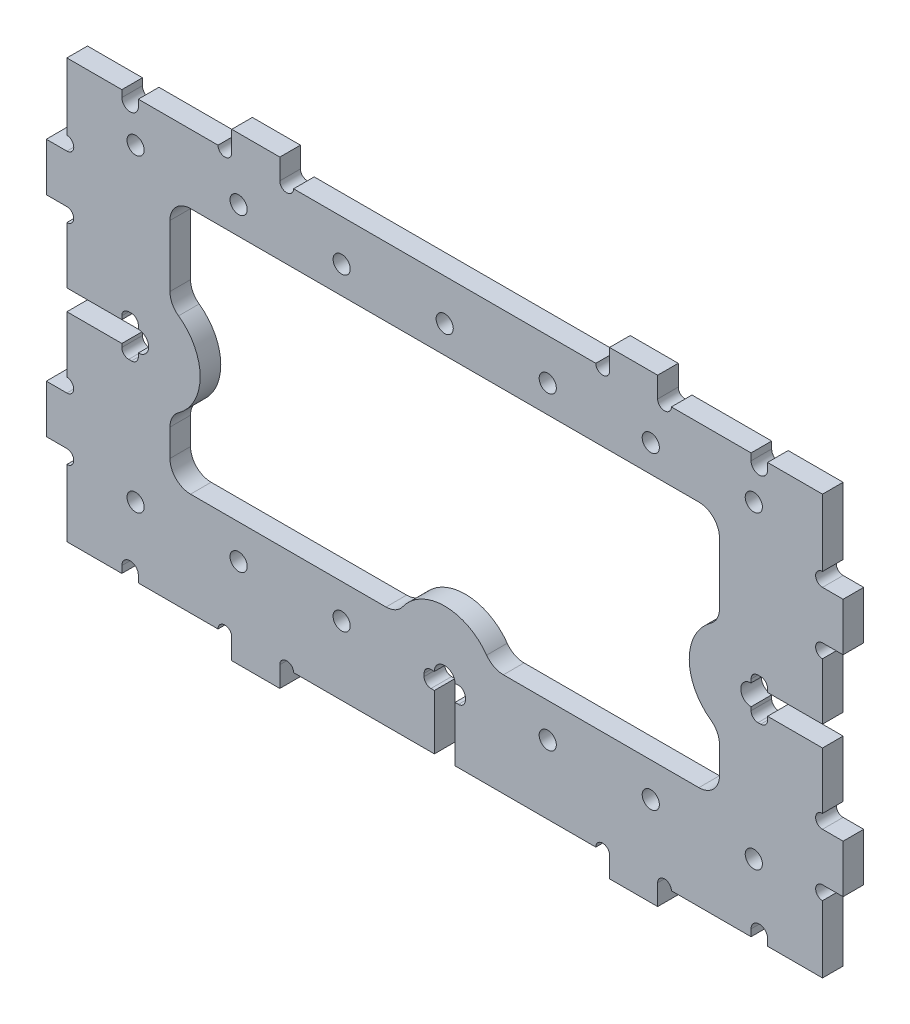
from build123d import *

# Parameters (mm, degrees)
BOSS_EXTRUDE1_DEPTH          = 3
CUT_EXTRUDE1_DEPTH           = 3
CUT_EXTRUDE3_DEPTH           = 3
FILLET2_R                    = 1
CUT_EXTRUDE4_DEPTH           = 10
FILLET3_R                    = 3
SKETCH5_W                    = 3
SKETCH5_H                    = 7
SKETCH5_W_2                  = 7
SKETCH5_H_2                  = 3
BOSS_EXTRUDE2_DEPTH          = 3
F_2_0_2_DIAMETER_HOLE1_D     = 2
F_2_0_2_DIAMETER_HOLE1_DEPTH = 6
F_2_0_2_DIAMETER_HOLE1_TIP   = 0.600860619
SKETCH9_R                    = 1.25
CUT_EXTRUDE5_DEPTH           = 10


with BuildPart() as part:
    # Sketch1 → Boss-Extrude1 (new body)
    with BuildSketch(Plane.XY):
        with BuildLine():
            Line((55, 30.5), (-55, 30.5))
            Line((-55, 30.5), (-55, 1.5))
            Line((-55, 1.5), (-47, 1.5))
            Line((-47, 1.5), (-47, 2))
            ThreePointArc((-47, 2), (-46.707106781, 2.707106781), (-46, 3))
            Line((-46, 3), (-45.6, 3))
            ThreePointArc((-45.6, 3), (-44.892893219, 2.707106781), (-44.6, 2))
            Line((-44.6, 2), (-44.6, 1.5))
            ThreePointArc((-44.6, 1.5), (-43.1, 0), (-44.6, -1.5))
            Line((-44.6, -1.5), (-44.6, -2))
            ThreePointArc((-44.6, -2), (-44.892893219, -2.707106781), (-45.6, -3))
            Line((-45.6, -3), (-46, -3))
            ThreePointArc((-46, -3), (-46.707106781, -2.707106781), (-47, -2))
            Line((-47, -2), (-47, -1.5))
            Line((-47, -1.5), (-55, -1.5))
            Line((-55, -1.5), (-55, -30.5))
            Line((-55, -30.5), (55, -30.5))
            Line((55, -30.5), (55, -1.5))
            Line((55, -1.5), (47, -1.5))
            Line((47, -1.5), (47, -2))
            ThreePointArc((47, -2), (46.707106781, -2.707106781), (46, -3))
            Line((46, -3), (45.6, -3))
            ThreePointArc((45.6, -3), (44.892893219, -2.707106781), (44.6, -2))
            Line((44.6, -2), (44.6, -1.5))
            ThreePointArc((44.6, -1.5), (43.1, 0), (44.6, 1.5))
            Line((44.6, 1.5), (44.6, 2))
            ThreePointArc((44.6, 2), (44.892893219, 2.707106781), (45.6, 3))
            Line((45.6, 3), (46, 3))
            ThreePointArc((46, 3), (46.707106781, 2.707106781), (47, 2))
            Line((47, 2), (47, 1.5))
            Line((47, 1.5), (55, 1.5))
            Line((55, 1.5), (55, 30.5))
        make_face()
    extrude(amount=BOSS_EXTRUDE1_DEPTH)

    # Sketch2 → Cut-Extrude1 (cut)
    with BuildSketch(Plane.XY.offset(3)):
        with BuildLine():
            Line((47, 30.5), (44.6, 30.5))
            Line((44.6, 30.5), (44.6, 29.5))
            ThreePointArc((44.6, 29.5), (45.8, 28.3), (47, 29.5))
            Line((47, 29.5), (47, 30.5))
        make_face()
        with BuildLine():
            Line((-47, 30.5), (-47, 29.5))
            ThreePointArc((-47, 29.5), (-45.8, 28.3), (-44.6, 29.5))
            Line((-44.6, 29.5), (-44.6, 30.5))
            Line((-44.6, 30.5), (-47, 30.5))
        make_face()
        with BuildLine():
            ThreePointArc((-44.6, -29.5), (-45.8, -28.3), (-47, -29.5))
            Line((-47, -29.5), (-47, -30.5))
            Line((-47, -30.5), (-44.6, -30.5))
            Line((-44.6, -30.5), (-44.6, -29.5))
        make_face()
        with BuildLine():
            Line((44.6, -29.5), (44.6, -30.5))
            Line((44.6, -30.5), (47, -30.5))
            Line((47, -30.5), (47, -29.5))
            ThreePointArc((47, -29.5), (45.8, -28.3), (44.6, -29.5))
        make_face()
    extrude(amount=-CUT_EXTRUDE1_DEPTH, mode=Mode.SUBTRACT)

    # Sketch3 → Cut-Extrude3 (cut)
    with BuildSketch(Plane.XY.offset(3)):
        with BuildLine():
            ThreePointArc((1.5, -20.1), (0, -18.6), (-1.5, -20.1))
            Line((-1.5, -20.1), (-3, -20.1))
            Line((-3, -20.1), (-3, -22.5))
            Line((-3, -22.5), (-1.5, -22.5))
            Line((-1.5, -22.5), (-1.5, -30.5))
            Line((-1.5, -30.5), (0, -30.5))
            Line((0, -30.5), (1.5, -30.5))
            Line((1.5, -30.5), (1.5, -22.5))
            Line((1.5, -22.5), (3, -22.5))
            Line((3, -22.5), (3, -20.1))
            Line((3, -20.1), (1.5, -20.1))
        make_face()
    extrude(amount=-CUT_EXTRUDE3_DEPTH, mode=Mode.SUBTRACT)

    # Fillet2
    fillet2_edges = [part.edges().sort_by_distance(p)[0] for p in [
        (-3, -20.1, 1.5),
        (3, -22.5, 1.5),
        (3, -20.1, 1.5),
        (-3, -22.5, 1.5),
    ]]
    fillet(fillet2_edges, radius=FILLET2_R)

    # Sketch4 → Cut-Extrude4 (cut)
    with BuildSketch(Plane.XY.offset(3)):
        with BuildLine():
            Line((40, 20.5), (-40, 20.5))
            Line((-40, 20.5), (-40, 6.829348432))
            ThreePointArc((-40, 6.829348432), (-36.795239894, 4.062019202), (-35.6, 0))
            ThreePointArc((-35.6, 0), (-36.795239894, -4.062019202), (-40, -6.829348432))
            Line((-40, -6.829348432), (-40, -15.5))
            Line((-40, -15.5), (-6.829348432, -15.5))
            ThreePointArc((-6.829348432, -15.5), (0, -11.1), (6.829348432, -15.5))
            Line((6.829348432, -15.5), (40, -15.5))
            Line((40, -15.5), (40, -6.829348432))
            ThreePointArc((40, -6.829348432), (35.6, 0), (40, 6.829348432))
            Line((40, 6.829348432), (40, 20.5))
        make_face()
    extrude(amount=-CUT_EXTRUDE4_DEPTH, mode=Mode.SUBTRACT)

    # Fillet3
    fillet3_edges = [part.edges().sort_by_distance(p)[0] for p in [
        (40, -6.829348432, 1.5),
        (40, -15.5, 1.5),
        (6.829348432, -15.5, 1.5),
        (-6.829348432, -15.5, 1.5),
        (-40, -6.829348432, 1.5),
        (-40, 6.829348432, 1.5),
        (40, 20.5, 1.5),
        (40, 6.829348432, 1.5),
        (-40, -15.5, 1.5),
        (-40, 20.5, 1.5),
    ]]
    fillet(fillet3_edges, radius=FILLET3_R)

    # Sketch5 → Boss-Extrude2 (add)
    with BuildSketch(Plane.XY.offset(3)):
        with Locations((-56.5, 15.25)):
            Rectangle(SKETCH5_W, SKETCH5_H)
        with Locations((-56.5, -15.25)):
            Rectangle(SKETCH5_W, SKETCH5_H)
        with Locations((56.5, -15.25)):
            Rectangle(SKETCH5_W, SKETCH5_H)
        with Locations((56.5, 15.25)):
            Rectangle(SKETCH5_W, SKETCH5_H)
        with Locations((27.5, -32)):
            Rectangle(SKETCH5_W_2, SKETCH5_H_2)
        with Locations((-27.5, -32)):
            Rectangle(SKETCH5_W_2, SKETCH5_H_2)
        with Locations((-27.5, 32)):
            Rectangle(SKETCH5_W_2, SKETCH5_H_2)
        with Locations((27.5, 32)):
            Rectangle(SKETCH5_W_2, SKETCH5_H_2)
    extrude(amount=-BOSS_EXTRUDE2_DEPTH)

    # Ø2.0 (2) Diameter Hole1
    with Locations(Plane(origin=(-23, 30.5, 3), x_dir=(1, 0, 0), z_dir=(0, 0, 1))):
        with Locations((0, 0), (-9, 0), (-32, -10.75), (-32, -19.75), (-32, -41.25), (-32, -50.25), (-9, -61), (0, -61), (46, -61), (55, -61), (78, -50.25), (78, -41.25), (78, -19.75), (78, -10.75), (55, 0), (46, 0)):
            Hole(F_2_0_2_DIAMETER_HOLE1_D / 2, depth=F_2_0_2_DIAMETER_HOLE1_DEPTH)
            with Locations((0, 0, -(F_2_0_2_DIAMETER_HOLE1_DEPTH + F_2_0_2_DIAMETER_HOLE1_TIP / 2))):  # 118° drill point
                Cone(0, F_2_0_2_DIAMETER_HOLE1_D / 2, F_2_0_2_DIAMETER_HOLE1_TIP, mode=Mode.SUBTRACT)

    # Sketch9 → Cut-Extrude5 (cut)
    with BuildSketch(Plane.XY.offset(3)):
        with Locations((0, 24.5)):
            Circle(SKETCH9_R)
        with Locations((15, 24.5)):
            Circle(SKETCH9_R)
        with Locations((30, 24.5)):
            Circle(SKETCH9_R)
        with Locations((45, 24.5)):
            Circle(SKETCH9_R)
        with Locations((-15, 24.5)):
            Circle(SKETCH9_R)
        with Locations((-30, 24.5)):
            Circle(SKETCH9_R)
        with Locations((-45, 24.5)):
            Circle(SKETCH9_R)
        with Locations((-15, -20.5)):
            Circle(SKETCH9_R)
        with Locations((-30, -20.5)):
            Circle(SKETCH9_R)
        with Locations((-45, -20.5)):
            Circle(SKETCH9_R)
        with Locations((15, -20.5)):
            Circle(SKETCH9_R)
        with Locations((30, -20.5)):
            Circle(SKETCH9_R)
        with Locations((45, -20.5)):
            Circle(SKETCH9_R)
    extrude(amount=-CUT_EXTRUDE5_DEPTH, mode=Mode.SUBTRACT)


solid = part.part
